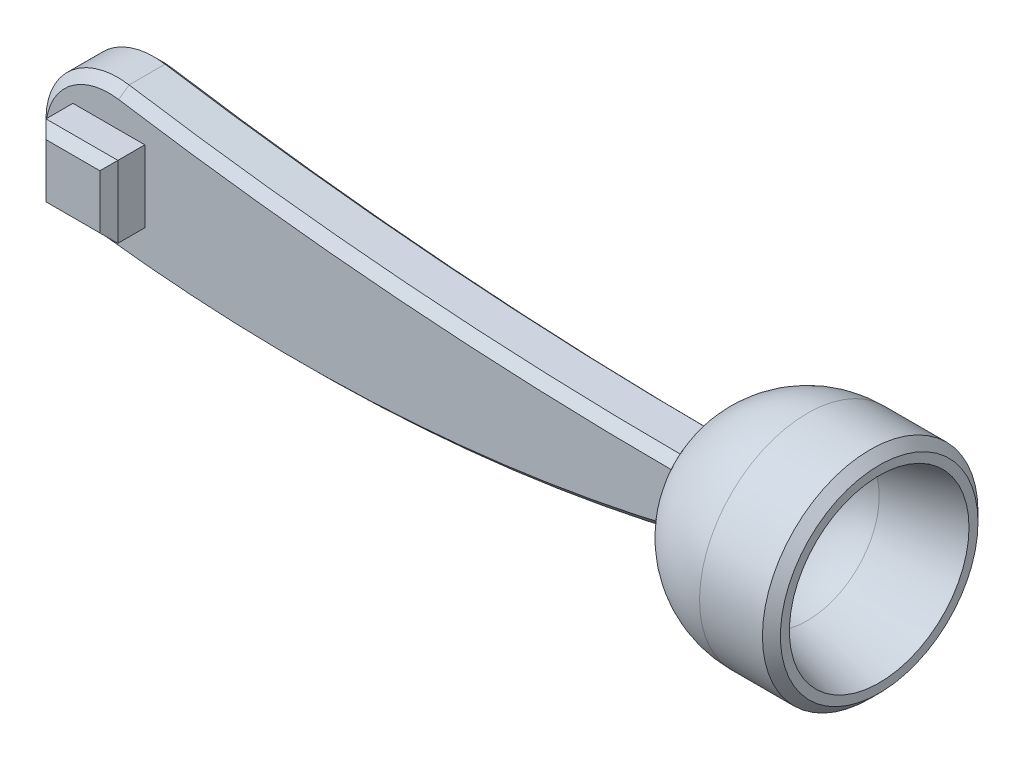
from build123d import *

# Parameters (mm, degrees)
BOSS_EXTRUDE1_DEPTH = 7.5
CHAMFER1_SIZE       = 2.5
SKETCH3_W           = 20
SKETCH3_H           = 20
BOSS_EXTRUDE2_DEPTH = 10
CHAMFER4_SIZE       = 2.5
SKETCH6_R           = 5
BOSS_EXTRUDE3_DEPTH = 10
CUT_EXTRUDE3_DEPTH  = 17
SKETCH11_R          = 30
SKETCH11_R_2        = 20
BOSS_EXTRUDE4_DEPTH = 20
CHAMFER5_SIZE2      = 20
CHAMFER5_SIZE       = 5
CHAMFER6_SIZE       = 2.5


with BuildPart() as part:
    # Sketch2 → Boss-Extrude1 (new, symmetric)
    with BuildSketch(Plane.XY):
        with BuildLine():
            ThreePointArc((84.922137279, 7.499595816), (1.268561005, 10.133701432), (-81.871756055, 19.753837344))
            ThreePointArc((-81.871756055, 19.753837344), (-104.803696773, 2.795280684), (-87.461525308, -19.847944306))
            ThreePointArc((-87.461525308, -19.847944306), (0.380210023, -22.09713345), (86.984359422, -7.232725467))
            ThreePointArc((86.984359422, -7.232725467), (92.427584063, 1.039709088), (84.922137279, 7.499595816))
        make_face()
    extrude(amount=BOSS_EXTRUDE1_DEPTH, both=True)

    # Chamfer1
    chamfer1_edges = [part.edges().sort_by_distance(p)[0] for p in [
        (92.427584063, 1.039709088, 7.5),
        (1.268561005, 10.133701432, 7.5),
        (-104.803696773, 2.795280684, 7.5),
        (0.380210023, -22.09713345, 7.5),
        (-104.803696773, 2.795280684, -7.5),
        (1.268561005, 10.133701432, -7.5),
        (92.427584063, 1.039709088, -7.5),
        (0.380210023, -22.09713345, -7.5),
    ]]
    chamfer(chamfer1_edges, length=CHAMFER1_SIZE)

    # Sketch3 → Boss-Extrude2 (add)
    with BuildSketch(Plane.XY.offset(7.5)):
        with Locations((-85, 0)):
            Rectangle(SKETCH3_W, SKETCH3_H)
    extrude(amount=BOSS_EXTRUDE2_DEPTH)

    # Chamfer4
    chamfer4_edges = [part.edges().sort_by_distance(p)[0] for p in [
        (-75, 0, 17.5),
        (-85, 10, 17.5),
        (-95, 0, 17.5),
        (-85, -10, 17.5),
    ]]
    chamfer(chamfer4_edges, length=CHAMFER4_SIZE)

    # Sketch6 → Boss-Extrude3 (add)
    with BuildSketch(Plane(origin=(0, 0, -7.5), x_dir=(-1, 0, 0), z_dir=(0, 0, -1))):
        with Locations(Location((85, 0, 0), (0, 0, 180))):
            Circle(SKETCH6_R)
    extrude(amount=BOSS_EXTRUDE3_DEPTH)

    # Sketch7 → Cut-Extrude3 (cut, symmetric)
    with BuildSketch(Plane(origin=(0, 0, 0), x_dir=(1, 0, 0), z_dir=(0, 1, 0))):
        with BuildLine():
            ThreePointArc((101.914257425, 20), (87.772121801, 14.142135624), (81.914257425, 0))
            Line((81.914257425, 0), (101.914257425, 0))
            Line((101.914257425, 0), (101.914257425, 20))
        make_face()
        with BuildLine():
            Line((101.914257425, 0), (81.914257425, 0))
            ThreePointArc((81.914257425, 0), (87.772121801, -14.142135624), (101.914257425, -20))
            Line((101.914257425, -20), (101.914257425, 0))
        make_face()
    extrude(amount=CUT_EXTRUDE3_DEPTH, both=True, mode=Mode.SUBTRACT)

    # Sketch7<5> one side → Revolve2 (revolve)
    with BuildSketch(Plane(origin=(0, 0, 0), x_dir=(1, 0, 0), z_dir=(0, 1, 0)), mode=Mode.PRIVATE) as revolve2_sk:
        with BuildLine():
            Line((101.914257425, 20), (101.914257425, 30))
            ThreePointArc((101.914257425, 30), (80.701053989, 21.213203436), (71.914257425, 0))
            Line((71.914257425, 0), (81.914257425, 0))
            ThreePointArc((81.914257425, 0), (87.772121801, 14.142135624), (101.914257425, 20))
        make_face()
    revolve(revolve2_sk.sketch.rotate(Axis((-136.30632513, 0, 0), (1, 0, 0)), 180), axis=Axis((-136.30632513, 0, 0), (1, 0, 0)))

    # Sketch11 → Boss-Extrude4 (add)
    with BuildSketch(Plane(origin=(101.914257425, 0, 0), x_dir=(0, 0, -1), z_dir=(1, 0, 0))):
        Circle(SKETCH11_R)
        with Locations(Location((0, 0, 0), (0, 0, 180))):
            Circle(SKETCH11_R_2, mode=Mode.SUBTRACT)
    extrude(amount=BOSS_EXTRUDE4_DEPTH)

    # Chamfer5
    chamfer5_edges = [part.edges().sort_by_distance(p)[0] for p in [
        (121.914257425, 0, -20),
    ]]
    chamfer5_side = [part.faces().sort_by_distance(p)[0] for p in [
        (121.914257425, 0, -20.1),
    ]]
    chamfer(chamfer5_edges, length=CHAMFER5_SIZE - 0.0001, length2=CHAMFER5_SIZE2 - 0.0001, reference=chamfer5_side[0])  # a hair under: the kernel refuses the full size

    # Chamfer6
    chamfer6_edges = [part.edges().sort_by_distance(p)[0] for p in [
        (121.914257425, 0, 30),
    ]]
    chamfer(chamfer6_edges, length=CHAMFER6_SIZE)


solid = part.part
